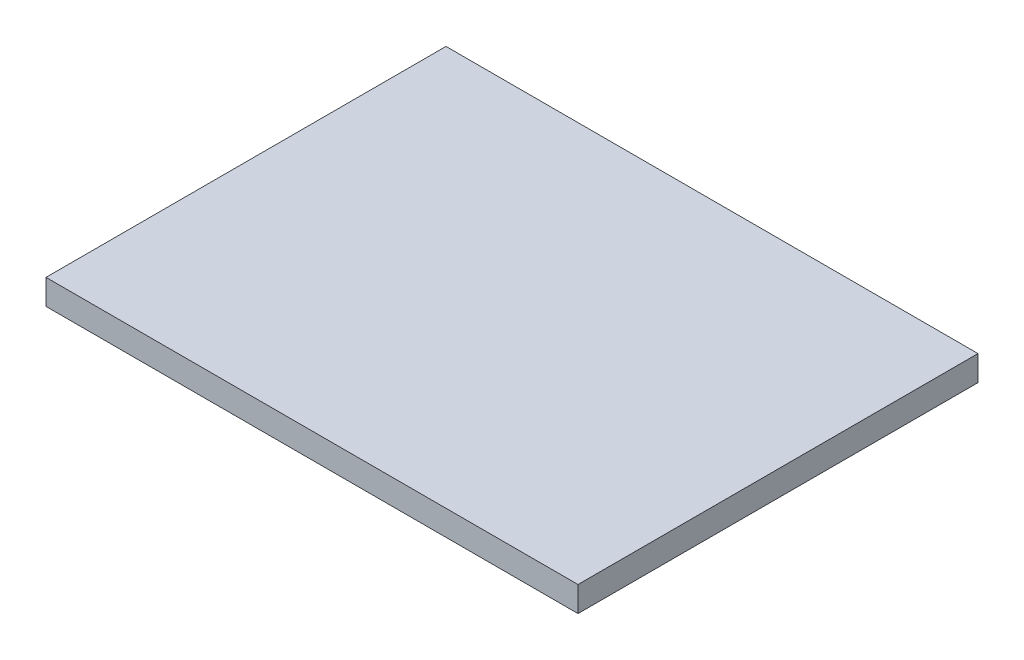
from build123d import *

# Parameters (mm, degrees)
SKETCH1_W           = 33.782
SKETCH1_H           = 25.4
BOSS_EXTRUDE1_DEPTH = 1.6


with BuildPart() as part:
    # Sketch1 → Boss-Extrude1 (new body)
    with BuildSketch(Plane(origin=(0, 0, 0), x_dir=(1, 0, 0), z_dir=(0, 1, 0))):
        Rectangle(SKETCH1_W, SKETCH1_H)
    extrude(amount=BOSS_EXTRUDE1_DEPTH)


solid = part.part
